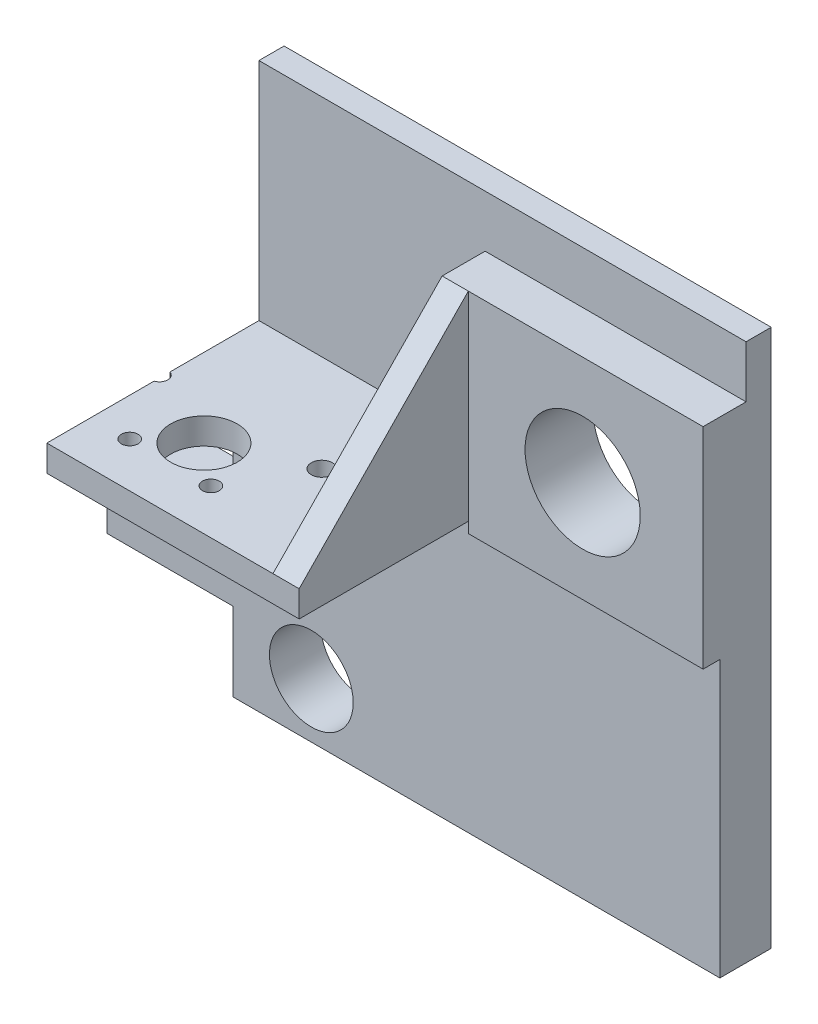
from build123d import *

# Parameters (mm, degrees)
SKETCH1_R           = 11
SKETCH1_R_2         = 8
BOSS_EXTRUDE1_DEPTH = 4.8
SKETCH2_W           = 44.821432693
SKETCH2_H           = 40.097165435
SKETCH2_R           = 11
BOSS_EXTRUDE2_DEPTH = 8.2
SKETCH3_R           = 8
BOSS_EXTRUDE3_DEPTH = 5
SKETCH4_R           = 6.35
SKETCH4_R_2         = 1.6
SKETCH4_R_3         = 2
BOSS_EXTRUDE4_DEPTH = 5
BOSS_EXTRUDE5_DEPTH = 5


with BuildPart() as part:
    # Sketch1 → Boss-Extrude1 (new body)
    with BuildSketch(Plane.XY):
        Polygon((-24, 30), (-24, 15), (0, 15), (0, 0), (93, 0), (93, 102.7), (0, 102.7), (0, 30), align=None)
        with Locations((70, 72)):
            Circle(SKETCH1_R, mode=Mode.SUBTRACT)
        with Locations((15, 10.5)):
            Circle(SKETCH1_R_2, mode=Mode.SUBTRACT)
    extrude(amount=BOSS_EXTRUDE1_DEPTH)

    # Sketch2 → Boss-Extrude2 (add)
    with BuildSketch(Plane.XY.offset(4.8)):
        with Locations((70.589283654, 72.714594712)):
            Rectangle(SKETCH2_W, SKETCH2_H)
        with Locations((70, 72)):
            Circle(SKETCH2_R, mode=Mode.SUBTRACT)
    extrude(amount=BOSS_EXTRUDE2_DEPTH)

    # Sketch3 → Boss-Extrude3 (add)
    with BuildSketch(Plane.XY.offset(4.8)):
        Polygon((-24, 30), (-24, 15), (0, 15), (0, 0), (93, 0), (93, 52.666011994), (0, 52.666011994), (0, 30), align=None)
        with Locations((15, 10.5)):
            Circle(SKETCH3_R, mode=Mode.SUBTRACT)
    extrude(amount=BOSS_EXTRUDE3_DEPTH)

    # Sketch4 → Boss-Extrude4 (add)
    with BuildSketch(Plane.XZ.offset(-59.700991)):
        with BuildLine():
            Line((0, 4.8), (48.178567307, 4.8))
            Line((48.178567307, 4.8), (48.178567307, 45.3))
            Line((48.178567307, 45.3), (0, 45.3))
            Line((0, 45.3), (0, 24.819868415))
            ThreePointArc((0, 24.819868415), (1.1, 23.3), (0, 21.780131585))
            Line((0, 21.780131585), (0, 4.8))
        make_face()
        with Locations((15, 30.3)):
            Circle(SKETCH4_R, mode=Mode.SUBTRACT)
        with Locations((7.25, 36.723393759)):
            Circle(SKETCH4_R_2, mode=Mode.SUBTRACT)
        with Locations((30.5, 23.3)):
            Circle(SKETCH4_R_3, mode=Mode.SUBTRACT)
        with Locations((22.75, 36.723393759)):
            Circle(SKETCH4_R_2, mode=Mode.SUBTRACT)
    extrude(amount=BOSS_EXTRUDE4_DEPTH)

    # Sketch5 → Boss-Extrude5 (add)
    with BuildSketch(Plane(origin=(48.178567307, 0, 0), x_dir=(0, 0, -1), z_dir=(1, 0, 0))):
        Polygon((-45.3, 59.700991), (-13, 92.763177429), (-4.8, 92.763177429), (-4.8, 54.700991), (-45.3, 54.700991), align=None)
    extrude(amount=-BOSS_EXTRUDE5_DEPTH)


solid = part.part
